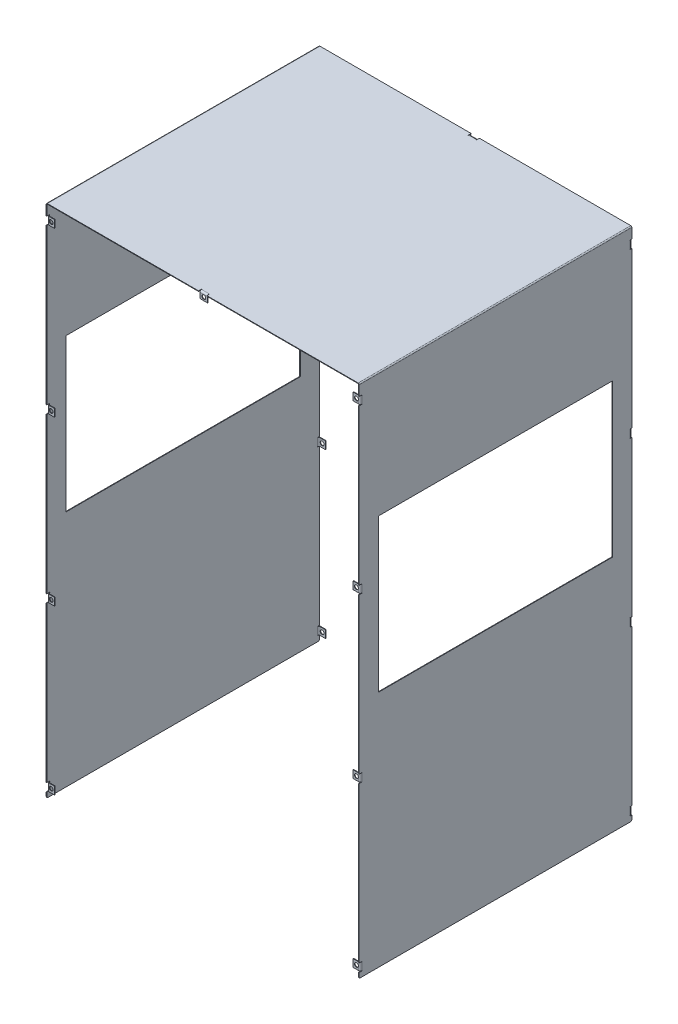
from build123d import *

# Parameters (mm, degrees)
SKETCH1_W                     = 572
SKETCH1_H                     = 500
BOSS_EXTRUDE1_DEPTH           = 2
CONVERT_SOLID1_OUTLINE_W      = 572
CONVERT_SOLID1_OUTLINE_H      = 500
CONVERT_SOLID1_DEPTH          = 1
EDGE_FLANGE1_STRIP_W          = 6
EDGE_FLANGE1_STRIP_H          = 1
EDGE_FLANGE1_STRIP_CUT_DEPTH  = 500
EDGE_FLANGE1_DEPTH            = 500
SKETCH14_W                    = 430
SKETCH14_H                    = 280
CUT_EXTRUDE4_DEPTH            = 600
FILLET1_R                     = 2
EDGE_FLANGE2_STRIP_W          = 10
EDGE_FLANGE2_STRIP_H          = 1
EDGE_FLANGE2_STRIP_CUT_DEPTH  = 14
EDGE_FLANGE2_RELIEF_W         = 10.5
EDGE_FLANGE2_RELIEF_H         = 0.5
EDGE_FLANGE2_RELIEF_CUT_DEPTH = 1
EDGE_FLANGE2_DEPTH            = 14
EDGE_FLANGE2_PROFILE_W        = 14
EDGE_FLANGE2_PROFILE_H        = 10
EDGE_FLANGE2_PROFILE_R        = 3.55
EDGE_FLANGE2_FLAT_DEPTH       = 1
EDGE_FLANGE3_STRIP_W          = 8
EDGE_FLANGE3_STRIP_H          = 1
EDGE_FLANGE3_STRIP_CUT_DEPTH  = 14
EDGE_FLANGE3_RELIEF_W         = 8.5
EDGE_FLANGE3_RELIEF_H         = 0.5
EDGE_FLANGE3_RELIEF_CUT_DEPTH = 1
EDGE_FLANGE3_DEPTH            = 14
EDGE_FLANGE3_PROFILE_W        = 14
EDGE_FLANGE3_PROFILE_H        = 10
EDGE_FLANGE3_PROFILE_R        = 3.55
EDGE_FLANGE3_FLAT_DEPTH       = 1
LPATTERN15_COUNT              = 4
LPATTERN15_PITCH              = 300
LPATTERN15_COPY_1_SKETCH_W    = 10
LPATTERN15_COPY_1_SKETCH_H    = 1
LPATTERN15_COPY_1_DEPTH       = 14
LPATTERN15_COPY_2_SKETCH_W    = 10
LPATTERN15_COPY_2_SKETCH_H    = 1
LPATTERN15_COPY_2_DEPTH       = 14
LPATTERN15_COPY_3_SKETCH_W    = 10
LPATTERN15_COPY_3_SKETCH_H    = 1
LPATTERN15_COPY_3_DEPTH       = 14
LPATTERN15_COPY_4_SKETCH_W    = 10.5
LPATTERN15_COPY_4_SKETCH_H    = 0.5
LPATTERN15_COPY_4_DEPTH       = 1
LPATTERN15_COPY_5_SKETCH_W    = 10.5
LPATTERN15_COPY_5_SKETCH_H    = 0.5
LPATTERN15_COPY_5_DEPTH       = 1
LPATTERN15_COPY_6_SKETCH_W    = 10.5
LPATTERN15_COPY_6_SKETCH_H    = 0.5
LPATTERN15_COPY_6_DEPTH       = 1
LPATTERN15_COPY_7_DEPTH       = 14
LPATTERN15_COPY_8_DEPTH       = 14
LPATTERN15_COPY_9_DEPTH       = 14
LPATTERN15_COPY_10_SKETCH_W   = 14
LPATTERN15_COPY_10_SKETCH_H   = 10
LPATTERN15_COPY_10_SKETCH_R   = 3.55
LPATTERN15_COPY_10_DEPTH      = 1
LPATTERN15_COPY_11_SKETCH_W   = 14
LPATTERN15_COPY_11_SKETCH_H   = 10
LPATTERN15_COPY_11_SKETCH_R   = 3.55
LPATTERN15_COPY_11_DEPTH      = 1
LPATTERN15_COPY_12_SKETCH_W   = 14
LPATTERN15_COPY_12_SKETCH_H   = 10
LPATTERN15_COPY_12_SKETCH_R   = 3.55
LPATTERN15_COPY_12_DEPTH      = 1
LPATTERN16_COUNT              = 4
LPATTERN16_PITCH              = 300
LPATTERN16_COPY_1_SKETCH_W    = 8
LPATTERN16_COPY_1_SKETCH_H    = 1
LPATTERN16_COPY_1_DEPTH       = 14
LPATTERN16_COPY_2_SKETCH_W    = 8
LPATTERN16_COPY_2_SKETCH_H    = 1
LPATTERN16_COPY_2_DEPTH       = 14
LPATTERN16_COPY_3_SKETCH_W    = 8
LPATTERN16_COPY_3_SKETCH_H    = 1
LPATTERN16_COPY_3_DEPTH       = 14
LPATTERN16_COPY_4_SKETCH_W    = 8.5
LPATTERN16_COPY_4_SKETCH_H    = 0.5
LPATTERN16_COPY_4_DEPTH       = 1
LPATTERN16_COPY_5_SKETCH_W    = 8.5
LPATTERN16_COPY_5_SKETCH_H    = 0.5
LPATTERN16_COPY_5_DEPTH       = 1
LPATTERN16_COPY_6_SKETCH_W    = 8.5
LPATTERN16_COPY_6_SKETCH_H    = 0.5
LPATTERN16_COPY_6_DEPTH       = 1
LPATTERN16_COPY_7_DEPTH       = 14
LPATTERN16_COPY_8_DEPTH       = 14
LPATTERN16_COPY_9_DEPTH       = 14
LPATTERN16_COPY_10_SKETCH_W   = 14
LPATTERN16_COPY_10_SKETCH_H   = 10
LPATTERN16_COPY_10_SKETCH_R   = 3.55
LPATTERN16_COPY_10_DEPTH      = 1
LPATTERN16_COPY_11_SKETCH_W   = 14
LPATTERN16_COPY_11_SKETCH_H   = 10
LPATTERN16_COPY_11_SKETCH_R   = 3.55
LPATTERN16_COPY_11_DEPTH      = 1
LPATTERN16_COPY_12_SKETCH_W   = 14
LPATTERN16_COPY_12_SKETCH_H   = 10
LPATTERN16_COPY_12_SKETCH_R   = 3.55
LPATTERN16_COPY_12_DEPTH      = 1
EDGE_FLANGE4_STRIP_W          = 10
EDGE_FLANGE4_STRIP_H          = 1
EDGE_FLANGE4_STRIP_CUT_DEPTH  = 14
EDGE_FLANGE4_RELIEF_W         = 10.5
EDGE_FLANGE4_RELIEF_H         = 0.5
EDGE_FLANGE4_RELIEF_CUT_DEPTH = 1
EDGE_FLANGE4_DEPTH            = 14
EDGE_FLANGE4_PROFILE_W        = 14
EDGE_FLANGE4_PROFILE_H        = 10
EDGE_FLANGE4_PROFILE_R        = 3.55
EDGE_FLANGE4_FLAT_DEPTH       = 1


# Read off the part's stored shape, not the designer's step: Convert-Solid1
# Sheet-metal steps are written as plain solids
with BuildPart() as part:
    # Sketch1 → Boss-Extrude1 (new body)
    with BuildSketch(Plane(origin=(0, 0, 0), x_dir=(1, 0, 0), z_dir=(0, 1, 0))):
        Rectangle(SKETCH1_W, SKETCH1_H)
    extrude(amount=BOSS_EXTRUDE1_DEPTH)

    # Convert-Solid1 outline → Convert-Solid1 (cut)
    with BuildSketch(Plane(origin=(0, 0, 0), x_dir=(1, 0, 0), z_dir=(0, 1, 0))):
        Rectangle(CONVERT_SOLID1_OUTLINE_W, CONVERT_SOLID1_OUTLINE_H)
    extrude(amount=CONVERT_SOLID1_DEPTH, mode=Mode.SUBTRACT)

    # Edge-Flange1 strip (across the edge) → Edge-Flange1 strip cut (cut)
    with BuildSketch(Plane(origin=(-286, 1, 250), x_dir=(1, 0, 0), z_dir=(0, 0, -1))):
        with Locations((-2, -0.5)):
            Rectangle(EDGE_FLANGE1_STRIP_W, EDGE_FLANGE1_STRIP_H)
    edge_flange1_strip_cut = extrude(amount=EDGE_FLANGE1_STRIP_CUT_DEPTH, mode=Mode.SUBTRACT)

    # Edge-Flange1 section (across the edge) → Edge-Flange1 (add)
    with BuildSketch(Plane(origin=(-286, 1, 250), x_dir=(1, 0, 0), z_dir=(0, 0, -1))):
        with BuildLine():
            Line((-1, 1), (-1, 944))
            Line((-1, 944), (0, 944))
            Line((0, 944), (0, 1))
            ThreePointArc((0, 1), (0.292893219, 0.292893219), (1, 0))
            Line((1, 0), (1, -1))
            ThreePointArc((1, -1), (-0.414213562, -0.414213562), (-1, 1))
        make_face()
    edge_flange1 = extrude(amount=EDGE_FLANGE1_DEPTH)

    # Mirror1: Edge-Flange1 strip cut, Edge-Flange1 across plane
    add(edge_flange1_strip_cut.mirror(Plane(origin=(0, 0, 0), x_dir=(0, 0, 1), z_dir=(1, 0, 0))), mode=Mode.SUBTRACT)
    add(edge_flange1.mirror(Plane(origin=(0, 0, 0), x_dir=(0, 0, 1), z_dir=(1, 0, 0))))

    # Sketch14 → Cut-Extrude4 (cut)
    with BuildSketch(Plane(origin=(-287, -1503.16698045, 2151.361494635), x_dir=(0, 0, -1), z_dir=(-1, 0, 0))):
        with Locations((2151.361494635, -1137.16698045)):
            Rectangle(SKETCH14_W, SKETCH14_H)
    extrude(amount=-CUT_EXTRUDE4_DEPTH, mode=Mode.SUBTRACT)

    # Fillet1
    fillet1_edges = [part.edges().sort_by_distance(p)[0] for p in [
        (-286.5, -943, 250),
        (-286.5, -943, -250),
        (286.5, -943, -250),
        (286.5, -943, 250),
    ]]
    fillet(fillet1_edges, radius=FILLET1_R)

    # Edge-Flange2 strip (across the edge) → Edge-Flange2 strip cut (cut)
    with BuildSketch(Plane(origin=(-286, -19, 248), x_dir=(0, 0, -1), z_dir=(0, -1, 0))):
        with Locations((-2, -0.5)):
            Rectangle(EDGE_FLANGE2_STRIP_W, EDGE_FLANGE2_STRIP_H)
    edge_flange2_strip_cut = extrude(amount=EDGE_FLANGE2_STRIP_CUT_DEPTH, mode=Mode.SUBTRACT)

    # Edge-Flange2 relief (on the sheet) → Edge-Flange2 relief cut (cut)
    with BuildSketch(Plane(origin=(-286, -19, 245), x_dir=(0, 0, -1), z_dir=(1, 0, 0))):
        with Locations((-4.75, 0.25)):
            Rectangle(EDGE_FLANGE2_RELIEF_W, EDGE_FLANGE2_RELIEF_H)
        with Locations((-4.75, -14.25)):
            Rectangle(EDGE_FLANGE2_RELIEF_W, EDGE_FLANGE2_RELIEF_H)
    edge_flange2_relief_cut = extrude(amount=-EDGE_FLANGE2_RELIEF_CUT_DEPTH, mode=Mode.SUBTRACT)

    # Edge-Flange2 bend section (across the edge) → Edge-Flange2 (add)
    with BuildSketch(Plane(origin=(-286, -19, 248), x_dir=(0, 0, -1), z_dir=(0, -1, 0))):
        with BuildLine():
            Line((0, 2), (1, 2))
            ThreePointArc((1, 2), (1.585786438, 0.585786438), (3, 0))
            Line((3, 0), (3, -1))
            ThreePointArc((3, -1), (0.878679656, -0.121320344), (0, 2))
        make_face()
    edge_flange2 = extrude(amount=EDGE_FLANGE2_DEPTH)

    # Edge-Flange2 profile (on flange) → Edge-Flange2 flat (add)
    with BuildSketch(Plane(origin=(-286, 0, 248), x_dir=(0, -1, 0), z_dir=(0, 0, 1))):
        with Locations((26, 7)):
            Rectangle(EDGE_FLANGE2_PROFILE_W, EDGE_FLANGE2_PROFILE_H)
        with Locations((26, 6)):
            Circle(EDGE_FLANGE2_PROFILE_R, mode=Mode.SUBTRACT)
    edge_flange2_flat = extrude(amount=-EDGE_FLANGE2_FLAT_DEPTH)

    # Edge-Flange3 strip (across the edge) → Edge-Flange3 strip cut (cut)
    with BuildSketch(Plane(origin=(-286, -33, -250), x_dir=(0, 0, 1), z_dir=(0, 1, 0))):
        with Locations((-1, -0.5)):
            Rectangle(EDGE_FLANGE3_STRIP_W, EDGE_FLANGE3_STRIP_H)
    edge_flange3_strip_cut = extrude(amount=EDGE_FLANGE3_STRIP_CUT_DEPTH, mode=Mode.SUBTRACT)

    # Edge-Flange3 relief (on the sheet) → Edge-Flange3 relief cut (cut)
    with BuildSketch(Plane(origin=(-286, -33, -247), x_dir=(0, 0, 1), z_dir=(1, 0, 0))):
        with Locations((-3.75, 0.25)):
            Rectangle(EDGE_FLANGE3_RELIEF_W, EDGE_FLANGE3_RELIEF_H)
        with Locations((-3.75, -14.25)):
            Rectangle(EDGE_FLANGE3_RELIEF_W, EDGE_FLANGE3_RELIEF_H)
    edge_flange3_relief_cut = extrude(amount=-EDGE_FLANGE3_RELIEF_CUT_DEPTH, mode=Mode.SUBTRACT)

    # Edge-Flange3 bend section (across the edge) → Edge-Flange3 (add)
    with BuildSketch(Plane(origin=(-286, -33, -250), x_dir=(0, 0, 1), z_dir=(0, 1, 0))):
        with BuildLine():
            Line((0, 2), (1, 2))
            ThreePointArc((1, 2), (1.585786438, 0.585786438), (3, 0))
            Line((3, 0), (3, -1))
            ThreePointArc((3, -1), (0.878679656, -0.121320344), (0, 2))
        make_face()
    edge_flange3 = extrude(amount=EDGE_FLANGE3_DEPTH)

    # Edge-Flange3 profile (on flange) → Edge-Flange3 flat (add)
    with BuildSketch(Plane(origin=(-286, 0, -250), x_dir=(0, 1, 0), z_dir=(0, 0, -1))):
        with Locations((-26, 7)):
            Rectangle(EDGE_FLANGE3_PROFILE_W, EDGE_FLANGE3_PROFILE_H)
        with Locations((-26, 6)):
            Circle(EDGE_FLANGE3_PROFILE_R, mode=Mode.SUBTRACT)
    edge_flange3_flat = extrude(amount=-EDGE_FLANGE3_FLAT_DEPTH)

    # Mirror23: Edge-Flange2 strip cut, Edge-Flange2 relief cut, Edge-Flange2, Edge-Flange2 flat across plane
    add(edge_flange2_strip_cut.mirror(Plane(origin=(0, 0, 0), x_dir=(0, 0, 1), z_dir=(1, 0, 0))), mode=Mode.SUBTRACT)
    add(edge_flange2_relief_cut.mirror(Plane(origin=(0, 0, 0), x_dir=(0, 0, 1), z_dir=(1, 0, 0))), mode=Mode.SUBTRACT)
    add(edge_flange2.mirror(Plane(origin=(0, 0, 0), x_dir=(0, 0, 1), z_dir=(1, 0, 0))))
    add(edge_flange2_flat.mirror(Plane(origin=(0, 0, 0), x_dir=(0, 0, 1), z_dir=(1, 0, 0))))

    # LPattern15: Edge-Flange2 strip cut, Edge-Flange2 relief cut, Edge-Flange2, Edge-Flange2 flat ×4
    with Locations(*[(0, -i * LPATTERN15_PITCH, 0) for i in range(1, LPATTERN15_COUNT)]):
        add(edge_flange2_strip_cut, mode=Mode.SUBTRACT)
        add(edge_flange2_relief_cut, mode=Mode.SUBTRACT)
        add(edge_flange2)
        add(edge_flange2_flat)

    # LPattern15 copy 1 sketch → LPattern15 copy 1 (cut)
    with BuildSketch(Plane(origin=(286, -319, 248), x_dir=(0, 0, -1), z_dir=(0, -1, 0))):
        with Locations((-2, 0.5)):
            Rectangle(LPATTERN15_COPY_1_SKETCH_W, LPATTERN15_COPY_1_SKETCH_H)
    extrude(amount=LPATTERN15_COPY_1_DEPTH, mode=Mode.SUBTRACT)

    # LPattern15 copy 2 sketch → LPattern15 copy 2 (cut)
    with BuildSketch(Plane(origin=(286, -619, 248), x_dir=(0, 0, -1), z_dir=(0, -1, 0))):
        with Locations((-2, 0.5)):
            Rectangle(LPATTERN15_COPY_2_SKETCH_W, LPATTERN15_COPY_2_SKETCH_H)
    extrude(amount=LPATTERN15_COPY_2_DEPTH, mode=Mode.SUBTRACT)

    # LPattern15 copy 3 sketch → LPattern15 copy 3 (cut)
    with BuildSketch(Plane(origin=(286, -919, 248), x_dir=(0, 0, -1), z_dir=(0, -1, 0))):
        with Locations((-2, 0.5)):
            Rectangle(LPATTERN15_COPY_3_SKETCH_W, LPATTERN15_COPY_3_SKETCH_H)
    extrude(amount=LPATTERN15_COPY_3_DEPTH, mode=Mode.SUBTRACT)

    # LPattern15 copy 4 sketch → LPattern15 copy 4 (cut)
    with BuildSketch(Plane(origin=(286, -319, 245), x_dir=(0, 0, -1), z_dir=(-1, 0, 0))):
        with Locations((-4.75, -0.25)):
            Rectangle(LPATTERN15_COPY_4_SKETCH_W, LPATTERN15_COPY_4_SKETCH_H)
        with Locations((-4.75, 14.25)):
            Rectangle(LPATTERN15_COPY_4_SKETCH_W, LPATTERN15_COPY_4_SKETCH_H)
    extrude(amount=-LPATTERN15_COPY_4_DEPTH, mode=Mode.SUBTRACT)

    # LPattern15 copy 5 sketch → LPattern15 copy 5 (cut)
    with BuildSketch(Plane(origin=(286, -619, 245), x_dir=(0, 0, -1), z_dir=(-1, 0, 0))):
        with Locations((-4.75, -0.25)):
            Rectangle(LPATTERN15_COPY_5_SKETCH_W, LPATTERN15_COPY_5_SKETCH_H)
        with Locations((-4.75, 14.25)):
            Rectangle(LPATTERN15_COPY_5_SKETCH_W, LPATTERN15_COPY_5_SKETCH_H)
    extrude(amount=-LPATTERN15_COPY_5_DEPTH, mode=Mode.SUBTRACT)

    # LPattern15 copy 6 sketch → LPattern15 copy 6 (cut)
    with BuildSketch(Plane(origin=(286, -919, 245), x_dir=(0, 0, -1), z_dir=(-1, 0, 0))):
        with Locations((-4.75, -0.25)):
            Rectangle(LPATTERN15_COPY_6_SKETCH_W, LPATTERN15_COPY_6_SKETCH_H)
        with Locations((-4.75, 14.25)):
            Rectangle(LPATTERN15_COPY_6_SKETCH_W, LPATTERN15_COPY_6_SKETCH_H)
    extrude(amount=-LPATTERN15_COPY_6_DEPTH, mode=Mode.SUBTRACT)

    # LPattern15 copy 7 sketch → LPattern15 copy 7 (add)
    with BuildSketch(Plane(origin=(286, -319, 248), x_dir=(0, 0, -1), z_dir=(0, -1, 0))):
        with BuildLine():
            Line((0, -2), (1, -2))
            ThreePointArc((1, -2), (1.585786438, -0.585786438), (3, 0))
            Line((3, 0), (3, 1))
            ThreePointArc((3, 1), (0.878679656, 0.121320344), (0, -2))
        make_face()
    extrude(amount=LPATTERN15_COPY_7_DEPTH)

    # LPattern15 copy 8 sketch → LPattern15 copy 8 (add)
    with BuildSketch(Plane(origin=(286, -619, 248), x_dir=(0, 0, -1), z_dir=(0, -1, 0))):
        with BuildLine():
            Line((0, -2), (1, -2))
            ThreePointArc((1, -2), (1.585786438, -0.585786438), (3, 0))
            Line((3, 0), (3, 1))
            ThreePointArc((3, 1), (0.878679656, 0.121320344), (0, -2))
        make_face()
    extrude(amount=LPATTERN15_COPY_8_DEPTH)

    # LPattern15 copy 9 sketch → LPattern15 copy 9 (add)
    with BuildSketch(Plane(origin=(286, -919, 248), x_dir=(0, 0, -1), z_dir=(0, -1, 0))):
        with BuildLine():
            Line((0, -2), (1, -2))
            ThreePointArc((1, -2), (1.585786438, -0.585786438), (3, 0))
            Line((3, 0), (3, 1))
            ThreePointArc((3, 1), (0.878679656, 0.121320344), (0, -2))
        make_face()
    extrude(amount=LPATTERN15_COPY_9_DEPTH)

    # LPattern15 copy 10 sketch → LPattern15 copy 10 (add)
    with BuildSketch(Plane(origin=(286, -300, 248), x_dir=(0, -1, 0), z_dir=(0, 0, 1))):
        with Locations((26, -7)):
            Rectangle(LPATTERN15_COPY_10_SKETCH_W, LPATTERN15_COPY_10_SKETCH_H)
        with Locations((26, -6)):
            Circle(LPATTERN15_COPY_10_SKETCH_R, mode=Mode.SUBTRACT)
    extrude(amount=-LPATTERN15_COPY_10_DEPTH)

    # LPattern15 copy 11 sketch → LPattern15 copy 11 (add)
    with BuildSketch(Plane(origin=(286, -600, 248), x_dir=(0, -1, 0), z_dir=(0, 0, 1))):
        with Locations((26, -7)):
            Rectangle(LPATTERN15_COPY_11_SKETCH_W, LPATTERN15_COPY_11_SKETCH_H)
        with Locations((26, -6)):
            Circle(LPATTERN15_COPY_11_SKETCH_R, mode=Mode.SUBTRACT)
    extrude(amount=-LPATTERN15_COPY_11_DEPTH)

    # LPattern15 copy 12 sketch → LPattern15 copy 12 (add)
    with BuildSketch(Plane(origin=(286, -900, 248), x_dir=(0, -1, 0), z_dir=(0, 0, 1))):
        with Locations((26, -7)):
            Rectangle(LPATTERN15_COPY_12_SKETCH_W, LPATTERN15_COPY_12_SKETCH_H)
        with Locations((26, -6)):
            Circle(LPATTERN15_COPY_12_SKETCH_R, mode=Mode.SUBTRACT)
    extrude(amount=-LPATTERN15_COPY_12_DEPTH)

    # Mirror24: Edge-Flange3 strip cut, Edge-Flange3 relief cut, Edge-Flange3, Edge-Flange3 flat across plane
    add(edge_flange3_strip_cut.mirror(Plane.ZY), mode=Mode.SUBTRACT)
    add(edge_flange3_relief_cut.mirror(Plane.ZY), mode=Mode.SUBTRACT)
    add(edge_flange3.mirror(Plane.ZY))
    add(edge_flange3_flat.mirror(Plane.ZY))

    # LPattern16: Edge-Flange3 strip cut, Edge-Flange3 relief cut, Edge-Flange3, Edge-Flange3 flat ×4
    with Locations(*[(0, -i * LPATTERN16_PITCH, 0) for i in range(1, LPATTERN16_COUNT)]):
        add(edge_flange3_strip_cut, mode=Mode.SUBTRACT)
        add(edge_flange3_relief_cut, mode=Mode.SUBTRACT)
        add(edge_flange3)
        add(edge_flange3_flat)

    # LPattern16 copy 1 sketch → LPattern16 copy 1 (cut)
    with BuildSketch(Plane(origin=(286, -333, -250), x_dir=(0, 0, 1), z_dir=(0, 1, 0))):
        with Locations((-1, 0.5)):
            Rectangle(LPATTERN16_COPY_1_SKETCH_W, LPATTERN16_COPY_1_SKETCH_H)
    extrude(amount=LPATTERN16_COPY_1_DEPTH, mode=Mode.SUBTRACT)

    # LPattern16 copy 2 sketch → LPattern16 copy 2 (cut)
    with BuildSketch(Plane(origin=(286, -633, -250), x_dir=(0, 0, 1), z_dir=(0, 1, 0))):
        with Locations((-1, 0.5)):
            Rectangle(LPATTERN16_COPY_2_SKETCH_W, LPATTERN16_COPY_2_SKETCH_H)
    extrude(amount=LPATTERN16_COPY_2_DEPTH, mode=Mode.SUBTRACT)

    # LPattern16 copy 3 sketch → LPattern16 copy 3 (cut)
    with BuildSketch(Plane(origin=(286, -933, -250), x_dir=(0, 0, 1), z_dir=(0, 1, 0))):
        with Locations((-1, 0.5)):
            Rectangle(LPATTERN16_COPY_3_SKETCH_W, LPATTERN16_COPY_3_SKETCH_H)
    extrude(amount=LPATTERN16_COPY_3_DEPTH, mode=Mode.SUBTRACT)

    # LPattern16 copy 4 sketch → LPattern16 copy 4 (cut)
    with BuildSketch(Plane(origin=(286, -333, -247), x_dir=(0, 0, 1), z_dir=(-1, 0, 0))):
        with Locations((-3.75, -0.25)):
            Rectangle(LPATTERN16_COPY_4_SKETCH_W, LPATTERN16_COPY_4_SKETCH_H)
        with Locations((-3.75, 14.25)):
            Rectangle(LPATTERN16_COPY_4_SKETCH_W, LPATTERN16_COPY_4_SKETCH_H)
    extrude(amount=-LPATTERN16_COPY_4_DEPTH, mode=Mode.SUBTRACT)

    # LPattern16 copy 5 sketch → LPattern16 copy 5 (cut)
    with BuildSketch(Plane(origin=(286, -633, -247), x_dir=(0, 0, 1), z_dir=(-1, 0, 0))):
        with Locations((-3.75, -0.25)):
            Rectangle(LPATTERN16_COPY_5_SKETCH_W, LPATTERN16_COPY_5_SKETCH_H)
        with Locations((-3.75, 14.25)):
            Rectangle(LPATTERN16_COPY_5_SKETCH_W, LPATTERN16_COPY_5_SKETCH_H)
    extrude(amount=-LPATTERN16_COPY_5_DEPTH, mode=Mode.SUBTRACT)

    # LPattern16 copy 6 sketch → LPattern16 copy 6 (cut)
    with BuildSketch(Plane(origin=(286, -933, -247), x_dir=(0, 0, 1), z_dir=(-1, 0, 0))):
        with Locations((-3.75, -0.25)):
            Rectangle(LPATTERN16_COPY_6_SKETCH_W, LPATTERN16_COPY_6_SKETCH_H)
        with Locations((-3.75, 14.25)):
            Rectangle(LPATTERN16_COPY_6_SKETCH_W, LPATTERN16_COPY_6_SKETCH_H)
    extrude(amount=-LPATTERN16_COPY_6_DEPTH, mode=Mode.SUBTRACT)

    # LPattern16 copy 7 sketch → LPattern16 copy 7 (add)
    with BuildSketch(Plane(origin=(286, -333, -250), x_dir=(0, 0, 1), z_dir=(0, 1, 0))):
        with BuildLine():
            Line((0, -2), (1, -2))
            ThreePointArc((1, -2), (1.585786438, -0.585786438), (3, 0))
            Line((3, 0), (3, 1))
            ThreePointArc((3, 1), (0.878679656, 0.121320344), (0, -2))
        make_face()
    extrude(amount=LPATTERN16_COPY_7_DEPTH)

    # LPattern16 copy 8 sketch → LPattern16 copy 8 (add)
    with BuildSketch(Plane(origin=(286, -633, -250), x_dir=(0, 0, 1), z_dir=(0, 1, 0))):
        with BuildLine():
            Line((0, -2), (1, -2))
            ThreePointArc((1, -2), (1.585786438, -0.585786438), (3, 0))
            Line((3, 0), (3, 1))
            ThreePointArc((3, 1), (0.878679656, 0.121320344), (0, -2))
        make_face()
    extrude(amount=LPATTERN16_COPY_8_DEPTH)

    # LPattern16 copy 9 sketch → LPattern16 copy 9 (add)
    with BuildSketch(Plane(origin=(286, -933, -250), x_dir=(0, 0, 1), z_dir=(0, 1, 0))):
        with BuildLine():
            Line((0, -2), (1, -2))
            ThreePointArc((1, -2), (1.585786438, -0.585786438), (3, 0))
            Line((3, 0), (3, 1))
            ThreePointArc((3, 1), (0.878679656, 0.121320344), (0, -2))
        make_face()
    extrude(amount=LPATTERN16_COPY_9_DEPTH)

    # LPattern16 copy 10 sketch → LPattern16 copy 10 (add)
    with BuildSketch(Plane(origin=(286, -300, -250), x_dir=(0, 1, 0), z_dir=(0, 0, -1))):
        with Locations((-26, -7)):
            Rectangle(LPATTERN16_COPY_10_SKETCH_W, LPATTERN16_COPY_10_SKETCH_H)
        with Locations((-26, -6)):
            Circle(LPATTERN16_COPY_10_SKETCH_R, mode=Mode.SUBTRACT)
    extrude(amount=-LPATTERN16_COPY_10_DEPTH)

    # LPattern16 copy 11 sketch → LPattern16 copy 11 (add)
    with BuildSketch(Plane(origin=(286, -600, -250), x_dir=(0, 1, 0), z_dir=(0, 0, -1))):
        with Locations((-26, -7)):
            Rectangle(LPATTERN16_COPY_11_SKETCH_W, LPATTERN16_COPY_11_SKETCH_H)
        with Locations((-26, -6)):
            Circle(LPATTERN16_COPY_11_SKETCH_R, mode=Mode.SUBTRACT)
    extrude(amount=-LPATTERN16_COPY_11_DEPTH)

    # LPattern16 copy 12 sketch → LPattern16 copy 12 (add)
    with BuildSketch(Plane(origin=(286, -900, -250), x_dir=(0, 1, 0), z_dir=(0, 0, -1))):
        with Locations((-26, -7)):
            Rectangle(LPATTERN16_COPY_12_SKETCH_W, LPATTERN16_COPY_12_SKETCH_H)
        with Locations((-26, -6)):
            Circle(LPATTERN16_COPY_12_SKETCH_R, mode=Mode.SUBTRACT)
    extrude(amount=-LPATTERN16_COPY_12_DEPTH)

    # Edge-Flange4 strip (across the edge) → Edge-Flange4 strip cut (cut)
    with BuildSketch(Plane(origin=(7, 1, 248), x_dir=(0, 0, -1), z_dir=(-1, 0, 0))):
        with Locations((-2, -0.5)):
            Rectangle(EDGE_FLANGE4_STRIP_W, EDGE_FLANGE4_STRIP_H)
    edge_flange4_strip_cut = extrude(amount=EDGE_FLANGE4_STRIP_CUT_DEPTH, mode=Mode.SUBTRACT)

    # Edge-Flange4 relief (on the sheet) → Edge-Flange4 relief cut (cut)
    with BuildSketch(Plane(origin=(7, 1, 245), x_dir=(0, 0, -1), z_dir=(0, -1, 0))):
        with Locations((-4.75, 0.25)):
            Rectangle(EDGE_FLANGE4_RELIEF_W, EDGE_FLANGE4_RELIEF_H)
        with Locations((-4.75, -14.25)):
            Rectangle(EDGE_FLANGE4_RELIEF_W, EDGE_FLANGE4_RELIEF_H)
    edge_flange4_relief_cut = extrude(amount=-EDGE_FLANGE4_RELIEF_CUT_DEPTH, mode=Mode.SUBTRACT)

    # Edge-Flange4 bend section (across the edge) → Edge-Flange4 (add)
    with BuildSketch(Plane(origin=(7, 1, 248), x_dir=(0, 0, -1), z_dir=(-1, 0, 0))):
        with BuildLine():
            Line((0, 2), (1, 2))
            ThreePointArc((1, 2), (1.585786438, 0.585786438), (3, 0))
            Line((3, 0), (3, -1))
            ThreePointArc((3, -1), (0.878679656, -0.121320344), (0, 2))
        make_face()
    edge_flange4 = extrude(amount=EDGE_FLANGE4_DEPTH)

    # Edge-Flange4 profile (on flange) → Edge-Flange4 flat (add)
    with BuildSketch(Plane(origin=(0, 1, 248), x_dir=(-1, 0, 0), z_dir=(0, 0, 1))):
        with Locations((0, 7)):
            Rectangle(EDGE_FLANGE4_PROFILE_W, EDGE_FLANGE4_PROFILE_H)
        with Locations((0, 6)):
            Circle(EDGE_FLANGE4_PROFILE_R, mode=Mode.SUBTRACT)
    edge_flange4_flat = extrude(amount=-EDGE_FLANGE4_FLAT_DEPTH)

    # Mirror25: Edge-Flange4 strip cut, Edge-Flange4 relief cut, Edge-Flange4, Edge-Flange4 flat across plane
    add(edge_flange4_strip_cut.mirror(Plane.XY), mode=Mode.SUBTRACT)
    add(edge_flange4_relief_cut.mirror(Plane.XY), mode=Mode.SUBTRACT)
    add(edge_flange4.mirror(Plane.XY))
    add(edge_flange4_flat.mirror(Plane.XY))


solid = part.part
